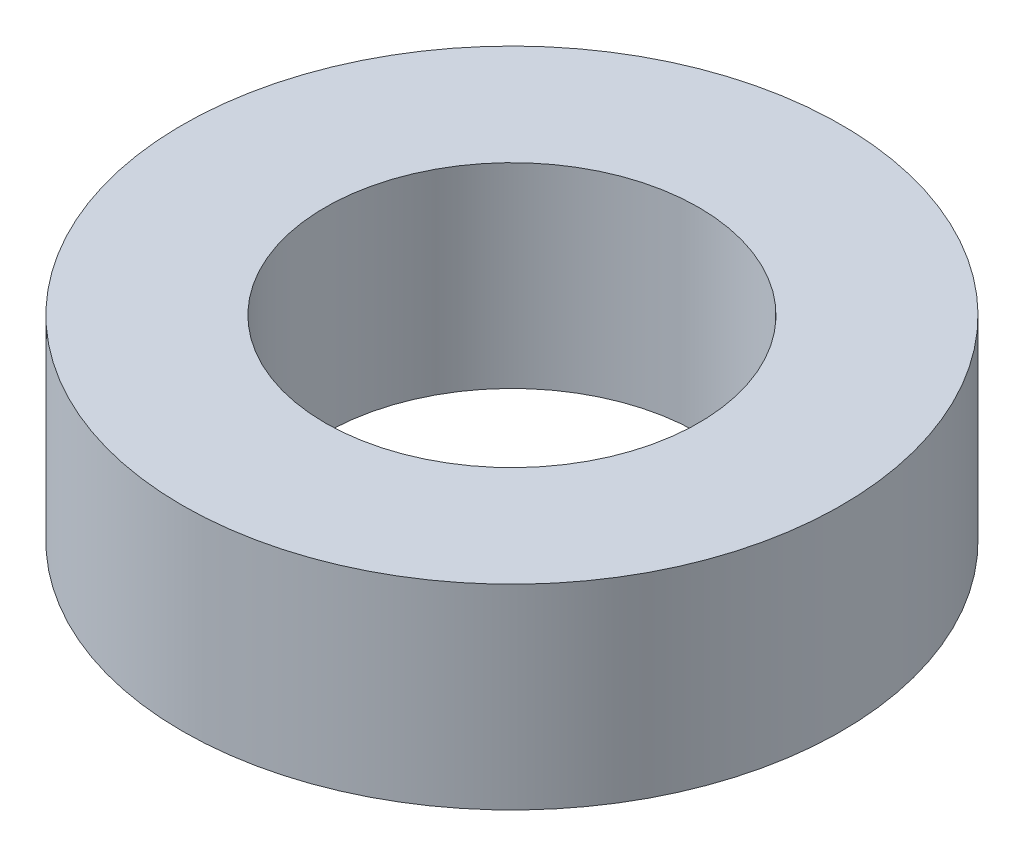
from build123d import *

# Parameters (mm, degrees)
SKETCH_2_R      = 15
SKETCH_2_R_2    = 8.5
EXTRUDE_1_DEPTH = 8.9


with BuildPart() as part:
    # Эскиз2 → Вытянуть1 (new body)
    with BuildSketch(Plane(origin=(0, 0, 0), x_dir=(1, 0, 0), z_dir=(0, 1, 0))):
        Circle(SKETCH_2_R)
        Circle(SKETCH_2_R_2, mode=Mode.SUBTRACT)
    extrude(amount=EXTRUDE_1_DEPTH)


solid = part.part
